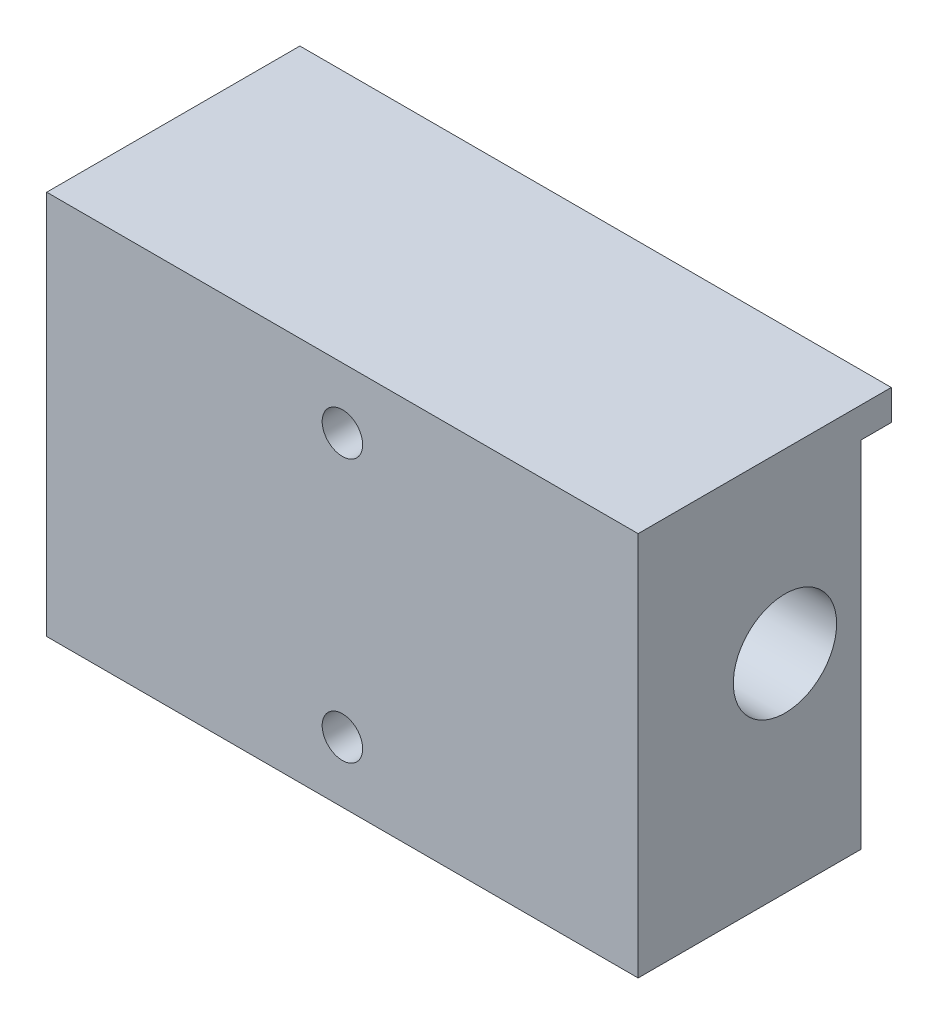
from build123d import *

# Parameters (mm, degrees)
CROQUIS1_W                                     = 58.4
CROQUIS1_H                                     = 38
SALIENTE_EXTRUIR1_DEPTH                        = 22
CROQUIS2_R                                     = 5.1
CORTAR_EXTRUIR1_DEPTH                          = 74.065450112
TALADROS_DE_ESPIGA_DE_4_0MM2_D                 = 4
TALADROS_DE_ESPIGA_DE_4_0MM2_DEPTH             = 14
TALADROS_DE_ESPIGA_DE_4_0MM2_TIP               = 1.201721238
CROQUIS6_W                                     = 58.4
CROQUIS6_H                                     = 3
SALIENTE_EXTRUIR2_DEPTH                        = 3
PERFORADOR_PARA_ROSCAR_PARA_MACHO_DE_ROS_D     = 2.5
PERFORADOR_PARA_ROSCAR_PARA_MACHO_DE_ROS_DEPTH = 14
PERFORADOR_PARA_ROSCAR_PARA_MACHO_DE_ROS_TIP   = 0.751075774


with BuildPart() as part:
    # Croquis1 → Saliente-Extruir1 (new body)
    with BuildSketch(Plane.XY):
        with Locations((29.2, 19)):
            Rectangle(CROQUIS1_W, CROQUIS1_H)
    extrude(amount=SALIENTE_EXTRUIR1_DEPTH)

    # Croquis2 → Cortar-Extruir1 (cut, through all)
    with BuildSketch(Plane(origin=(58.4, 0, 0), x_dir=(0, 0, -1), z_dir=(1, 0, 0))):
        with Locations((-7.5, 20.5)):
            Circle(CROQUIS2_R)
    extrude(amount=-CORTAR_EXTRUIR1_DEPTH, mode=Mode.SUBTRACT)

    # Taladros de espiga de Ø4.0mm2
    with Locations(Plane.XY.offset(22)):
        with Locations((29.2, 6), (29.2, 32)):
            Hole(TALADROS_DE_ESPIGA_DE_4_0MM2_D / 2, depth=TALADROS_DE_ESPIGA_DE_4_0MM2_DEPTH)
            with Locations((0, 0, -(TALADROS_DE_ESPIGA_DE_4_0MM2_DEPTH + TALADROS_DE_ESPIGA_DE_4_0MM2_TIP / 2))):  # 118° drill point
                Cone(0, TALADROS_DE_ESPIGA_DE_4_0MM2_D / 2, TALADROS_DE_ESPIGA_DE_4_0MM2_TIP, mode=Mode.SUBTRACT)

    # Croquis6 → Saliente-Extruir2 (add)
    with BuildSketch(Plane(origin=(0, 0, 0), x_dir=(-1, 0, 0), z_dir=(0, 0, -1))):
        with Locations((-29.2, 36.5)):
            Rectangle(CROQUIS6_W, CROQUIS6_H)
    extrude(amount=SALIENTE_EXTRUIR2_DEPTH)

    # Perforador para roscar para macho de roscar para M33
    with Locations(Plane.ZY):
        with Locations((15.5, 20.5), (7.5, 12.5), (7.5, 28.5)):
            Hole(PERFORADOR_PARA_ROSCAR_PARA_MACHO_DE_ROS_D / 2, depth=PERFORADOR_PARA_ROSCAR_PARA_MACHO_DE_ROS_DEPTH)
            with Locations((0, 0, -(PERFORADOR_PARA_ROSCAR_PARA_MACHO_DE_ROS_DEPTH + PERFORADOR_PARA_ROSCAR_PARA_MACHO_DE_ROS_TIP / 2))):  # 118° drill point
                Cone(0, PERFORADOR_PARA_ROSCAR_PARA_MACHO_DE_ROS_D / 2, PERFORADOR_PARA_ROSCAR_PARA_MACHO_DE_ROS_TIP, mode=Mode.SUBTRACT)


solid = part.part
